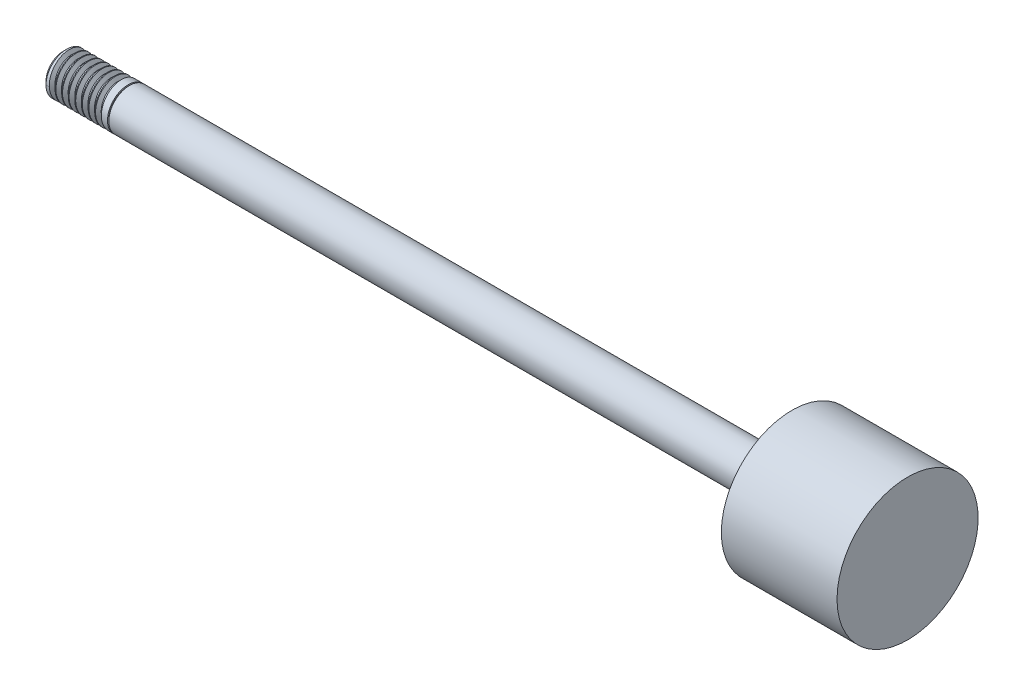
from build123d import *
from build123d.topology import SkipClean

# Parameters (mm, degrees)
THREAD1_PITCH = 1.27


with BuildPart() as part:
    # Sketch1 → Revolve1 (revolve)
    with BuildSketch(Plane(origin=(0, 0, 0), x_dir=(-1, 0, 0), z_dir=(0, 0, -1)), mode=Mode.PRIVATE) as revolve1_sk:
        Polygon((-149.5044, 13.55725), (-149.5044, 0), (12.7, 0), (12.7, 3.33883), (12.07008, 3.96875), (0.254, 3.96875), (0.254, 3.71475), (0, 3.71475), (0, 3.9624), (-127.2794, 3.9624), (-127.2794, 13.55725), align=None)
    revolve(revolve1_sk.sketch.rotate(Axis((149.5044, 0, 0), (-1, 0, 0)), 270), axis=Axis((149.5044, 0, 0), (-1, 0, 0)))

    # Thread1: the profile of Thread Profile1 profile screwed along a right-hand helix of 7.874016 turns, 8 arcs to a turn; built about Z, then put on its axis
    with SkipClean():  # the faces are left unmerged after this step: merging them gives an invalid solid
        thread1_z = Axis((0, 0, 0), (0, 0, 1))
        thread1_corners = [(3.96905, 0, -0.000173205), (3.96905, 0, 1.111423202), (3.281342339, 0, 0.714374998), (3.281342339, 0, 0.396874998)]
        with BuildLine(mode=Mode.PRIVATE) as thread1_profile:
            Line(thread1_corners[0], thread1_corners[1])
            Line(thread1_corners[1], thread1_corners[2])
            Line(thread1_corners[2], thread1_corners[3])
            Line(thread1_corners[3], thread1_corners[0])
        thread1_cap = Face(thread1_profile.wire())
        thread1_turn_angles = [0, 22.5, 45, 67.5, 90, 112.5, 135, 157.5, 180, 202.5, 225, 247.5, 270, 292.5, 315, 337.5, 360]
        thread1_turn_weights = [1, 0.9238795325112867, 1, 0.9238795325112867, 1, 0.9238795325112867, 1, 0.9238795325112867, 1, 0.9238795325112867, 1, 0.9238795325112867, 1, 0.9238795325112867, 1, 0.9238795325112867, 1]
        thread1_turn_rails = [Edge.make_bspline([Vector(p[0], p[1], 0).rotate(thread1_z, thread1_turn_angles[k]) / thread1_turn_weights[k] + Vector(0, 0, p[2] + THREAD1_PITCH * thread1_turn_angles[k] / 360) for k in range(17)], [0, 0, 0, 1, 1, 2, 2, 3, 3, 4, 4, 5, 5, 6, 6, 7, 7, 8, 8, 8], 2, thread1_turn_weights) for p in thread1_corners]
        thread1_turn_sides = [Face.make_surface_from_curves(thread1_turn_rails[p[0]], thread1_turn_rails[p[1]]) for p in [(0, 1), (1, 2), (2, 3), (3, 0)]]
        thread1_last_angles = [2520, 2542.5, 2565, 2587.5, 2610, 2632.5, 2655, 2677.5, 2700, 2722.5, 2745, 2767.5, 2790, 2812.322834646, 2834.645669291]
        thread1_last_weights = [1, 0.9238795325112867, 1, 0.9238795325112867, 1, 0.9238795325112867, 1, 0.9238795325112867, 1, 0.9238795325112867, 1, 0.9238795325112867, 1, 0.9250584165493104, 1]
        thread1_last_rails = [Edge.make_bspline([Vector(p[0], p[1], 0).rotate(thread1_z, thread1_last_angles[k]) / thread1_last_weights[k] + Vector(0, 0, p[2] + THREAD1_PITCH * thread1_last_angles[k] / 360) for k in range(15)], [0, 0, 0, 1, 1, 2, 2, 3, 3, 4, 4, 5, 5, 6, 6, 7, 7, 7], 2, thread1_last_weights) for p in thread1_corners]
        thread1_last_sides = [Face.make_surface_from_curves(thread1_last_rails[p[0]], thread1_last_rails[p[1]]) for p in [(0, 1), (1, 2), (2, 3), (3, 0)]]
        thread1 = Plane(origin=(-12.07008, 0, 0), x_dir=(0, 0, -1), z_dir=(1, 0, 0)) * Solid(Shell([*[p.moved(Location((0, 0, THREAD1_PITCH * i))) for i in range(7) for p in thread1_turn_sides], *thread1_last_sides, thread1_cap, thread1_cap.rotate(thread1_z, 2834.645669291).moved(Location((0, 0, THREAD1_PITCH * 2834.645669291 / 360)))]))
        add(thread1, mode=Mode.SUBTRACT)


solid = part.part
